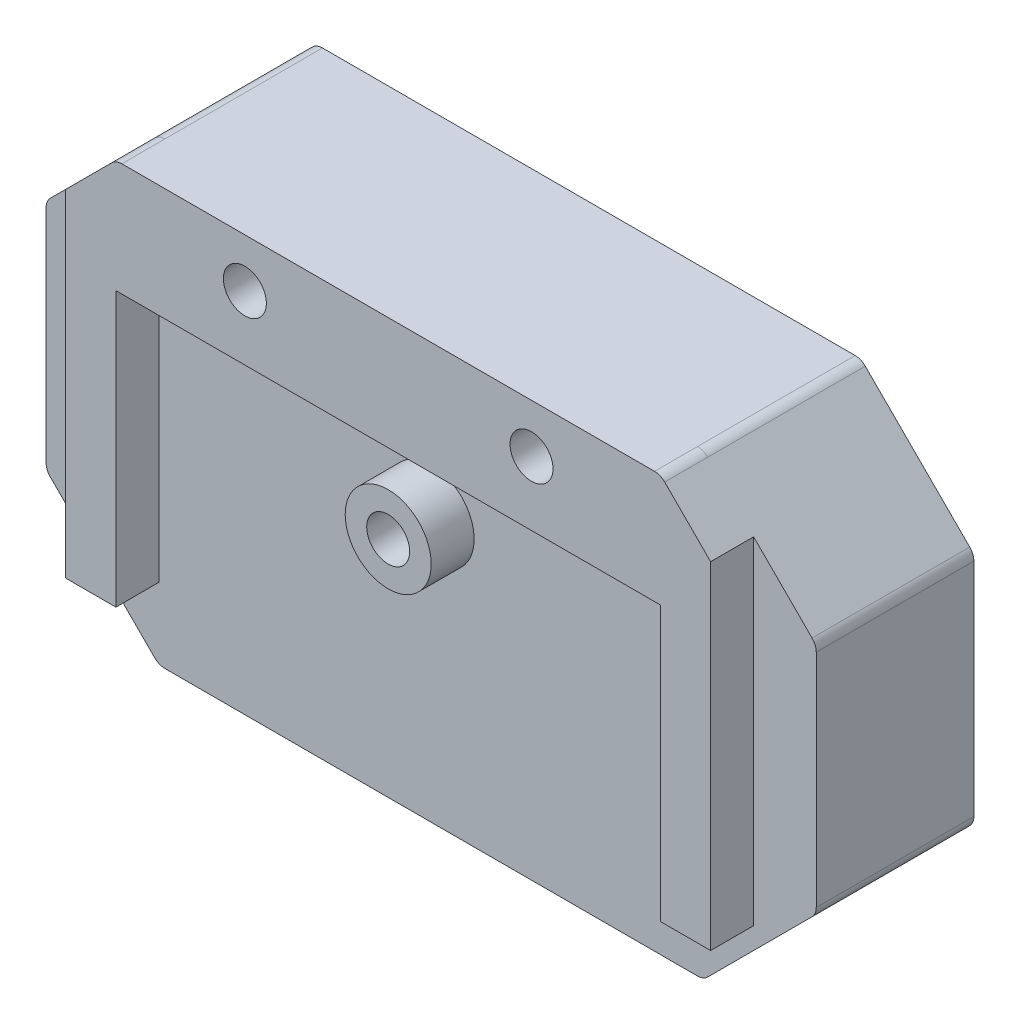
from build123d import *
from build123d.topology import SkipClean

# Parameters (mm, degrees)
CROQUIS3_W                   = 38
CROQUIS3_H                   = 38
SALIENTE_EXTRUIR9_DEPTH      = 1
SALIENTE_EXTRUIR10_START     = -11
SALIENTE_EXTRUIR10_OUTLINE_W = 38
SALIENTE_EXTRUIR10_OUTLINE_H = 38
SALIENTE_EXTRUIR10_DEPTH     = 10
CROQUIS13_W                  = 38
CROQUIS13_H                  = 38
SALIENTE_EXTRUIR15_DEPTH     = 3
CROQUIS14_R                  = 1.5
CORTAR_EXTRUIR1_DEPTH        = 14
CROQUIS15_W                  = 38
CROQUIS15_H                  = 24.129942315
CROQUIS15_R                  = 1.5
CROQUIS15_R_2                = 3.5
SALIENTE_EXTRUIR16_DEPTH     = 1
CORTAR_EXTRUIR2_DEPTH        = 14
CROQUIS17_R                  = 1.5
SALIENTE_EXTRUIR17_DEPTH     = 5
CROQUIS18_R                  = 1.5
CROQUIS18_W                  = 12
CROQUIS18_H                  = 12
SALIENTE_EXTRUIR18_DEPTH     = 5
CORTAR_EXTRUIR3_DEPTH        = 3
CROQUIS20_R                  = 3
CROQUIS20_R_2                = 1.5
SALIENTE_EXTRUIR19_DEPTH     = 3
REDONDEO11_R                 = 1
CROQUIS21_W                  = 12
CROQUIS21_H                  = 3
SALIENTE_EXTRUIR20_DEPTH     = 10


# Read off the part's stored shape, not the designer's step: Saliente-Extruir10
with BuildPart() as part:
    # Croquis3 → Saliente-Extruir9 (new body)
    with BuildSketch(Plane.XY.offset(5)):
        Polygon((19, -5.370057685), (26.870057685, 2.5), (26.870057685, 40.5), (19, 48.370057685), (-19, 48.370057685), (-26.870057685, 40.5), (-26.870057685, 2.5), (-19, -5.370057685), align=None)
        with Locations((0, 21.5)):
            Rectangle(CROQUIS3_W, CROQUIS3_H, mode=Mode.SUBTRACT)
    extrude(amount=-SALIENTE_EXTRUIR9_DEPTH)

    # Saliente-Extruir10 outline → Saliente-Extruir10 (add)
    with BuildSketch(Plane(origin=(0, 0, 4), x_dir=(-1, 0, 0), z_dir=(0, 0, -1)).offset(SALIENTE_EXTRUIR10_START)):
        Polygon((-26.870057685, 2.5), (-19, -5.370057685), (19, -5.370057685), (26.870057685, 2.5), (26.870057685, 40.5), (19, 48.370057685), (-19, 48.370057685), (-26.870057685, 40.5), align=None)
        with Locations((0, 21.5)):
            Rectangle(SALIENTE_EXTRUIR10_OUTLINE_W, SALIENTE_EXTRUIR10_OUTLINE_H, mode=Mode.SUBTRACT)
    extrude(amount=SALIENTE_EXTRUIR10_DEPTH)

    # Croquis13 → Saliente-Extruir15 (add)
    with BuildSketch(Plane.XY.offset(15)):
        with BuildLine():
            Line((-22.5, 44.870057685), (-22.5, -1))
            Line((-22.5, -1), (22.5, -1))
            Line((22.5, -1), (22.5, 44.870057685))
            Line((22.5, 44.870057685), (19.292893219, 48.077164466))
            ThreePointArc((19.292893219, 48.077164466), (18.96846987, 48.293937218), (18.585786438, 48.370057685))
            Line((18.585786438, 48.370057685), (-18.585786438, 48.370057685))
            ThreePointArc((-18.585786438, 48.370057685), (-18.96846987, 48.293937218), (-19.292893219, 48.077164466))
            Line((-19.292893219, 48.077164466), (-22.5, 44.870057685))
        make_face()
        with Locations((0, 21.5)):
            Rectangle(CROQUIS13_W, CROQUIS13_H, mode=Mode.SUBTRACT)
    extrude(amount=SALIENTE_EXTRUIR15_DEPTH)

    # Croquis14 → Cortar-Extruir1 (cut)
    with BuildSketch(Plane(origin=(0, 0, 4), x_dir=(-1, 0, 0), z_dir=(0, 0, -1))):
        with Locations((10, 44.97415474)):
            Circle(CROQUIS14_R)
        with Locations(Location((-10, 44.97415474, 0), (0, 0, 180))):
            Circle(CROQUIS14_R)
    extrude(amount=-CORTAR_EXTRUIR1_DEPTH, mode=Mode.SUBTRACT)

    # Croquis15 → Saliente-Extruir16 (add)
    with BuildSketch(Plane(origin=(0, 0, 4), x_dir=(-1, 0, 0), z_dir=(0, 0, -1))):
        with Locations((0, 28.435028843)):
            Rectangle(CROQUIS15_W, CROQUIS15_H)
        with Locations((0, 34.97415474)):
            Circle(CROQUIS15_R, mode=Mode.SUBTRACT)
        with Locations((0, 25.370057685)):
            Circle(CROQUIS15_R_2, mode=Mode.SUBTRACT)
    extrude(amount=-SALIENTE_EXTRUIR16_DEPTH)

    # Croquis16 → Cortar-Extruir2 (cut)
    with BuildSketch(Plane(origin=(0, 0, 4), x_dir=(-1, 0, 0), z_dir=(0, 0, -1))):
        Polygon((-19, 2.5), (-19, 16.370057685), (-26.870057685, 24.24011537), (-26.870057685, 2.5), (-19, -5.370057685), (19, -5.370057685), (26.870057685, 2.5), (26.870057685, 24.24011537), (19, 16.370057685), (19, 2.5), align=None)
    extrude(amount=-CORTAR_EXTRUIR2_DEPTH, mode=Mode.SUBTRACT)

    # Croquis17 → Saliente-Extruir17 (add)
    with SkipClean():  # the faces are left unmerged after this step: merging them gives an invalid solid
        with BuildSketch(Plane.XY.offset(5)):
            Polygon((6, 31.370057685), (6, 25.370057685), (6, 19.370057685), (6, 16.370057685), (19, 16.370057685), (19, 40.5), (-19, 40.5), (-19, 16.370057685), (-6, 16.370057685), (-6, 19.370057685), (-6, 31.370057685), align=None)
            with Locations((0, 34.97415474)):
                Circle(CROQUIS17_R, mode=Mode.SUBTRACT)
        extrude(amount=SALIENTE_EXTRUIR17_DEPTH)
    add(part.part.scale(1), mode=Mode.REPLACE)  # the faces are merged on a copy

    # Croquis18 → Saliente-Extruir18 (add)
    # profile 1 of 2: a face of its own
    with BuildSketch(Plane.XY.offset(10)):
        Polygon((-6, 31.370057685), (6, 31.370057685), (6, 16.370057685), (19, 16.370057685), (19, 40.5), (-19, 40.5), (-19, 16.370057685), (-6, 16.370057685), align=None)
        with Locations(Location((0, 34.97415474, 0), (0, 0, 180))):
            Circle(CROQUIS18_R, mode=Mode.SUBTRACT)
    # profile 2 of 2: a face of its own
    with BuildSketch(Plane.XY.offset(10)):
        with Locations((0, 25.370057685)):
            Rectangle(CROQUIS18_W, CROQUIS18_H)
    extrude(amount=SALIENTE_EXTRUIR18_DEPTH)

    # Croquis19 → Cortar-Extruir3 (cut)
    with BuildSketch(Plane.XY.offset(18)):
        Polygon((-22.5, 19.870057685), (-19, 16.370057685), (-19, 21.370057685), (-22.5, 21.370057685), align=None)
        Polygon((19, 16.370057685), (22.5, 19.870057685), (22.5, 21.370057685), (19, 21.370057685), align=None)
    extrude(amount=-CORTAR_EXTRUIR3_DEPTH, mode=Mode.SUBTRACT)

    # Croquis20 → Saliente-Extruir19 (add)
    with BuildSketch(Plane.XY.offset(15)):
        with Locations(Location((0, 34.97415474, 0), (0, 0, 180))):
            Circle(CROQUIS20_R)
        with Locations(Location((0, 34.97415474, 0), (0, 0, 180))):
            Circle(CROQUIS20_R_2, mode=Mode.SUBTRACT)
    extrude(amount=SALIENTE_EXTRUIR19_DEPTH)

    # Redondeo11
    redondeo11_edges = [part.edges().sort_by_distance(p)[0] for p in [
        (26.870057685, 40.5, 10),
        (19, 48.370057685, 10),
        (-19, 48.370057685, 10),
        (-26.870057685, 40.5, 10),
        (26.870057685, 24.24011537, 9.5),
        (19, 16.370057685, 9.5),
        (-26.870057685, 24.24011537, 9.5),
        (-19, 16.370057685, 9.5),
    ]]
    fillet(redondeo11_edges, radius=REDONDEO11_R)

    # Croquis21 → Saliente-Extruir20 (add)
    with BuildSketch(Plane.XY.offset(5)):
        with Locations((0, 17.870057685)):
            Rectangle(CROQUIS21_W, CROQUIS21_H)
    extrude(amount=SALIENTE_EXTRUIR20_DEPTH)


solid = part.part
